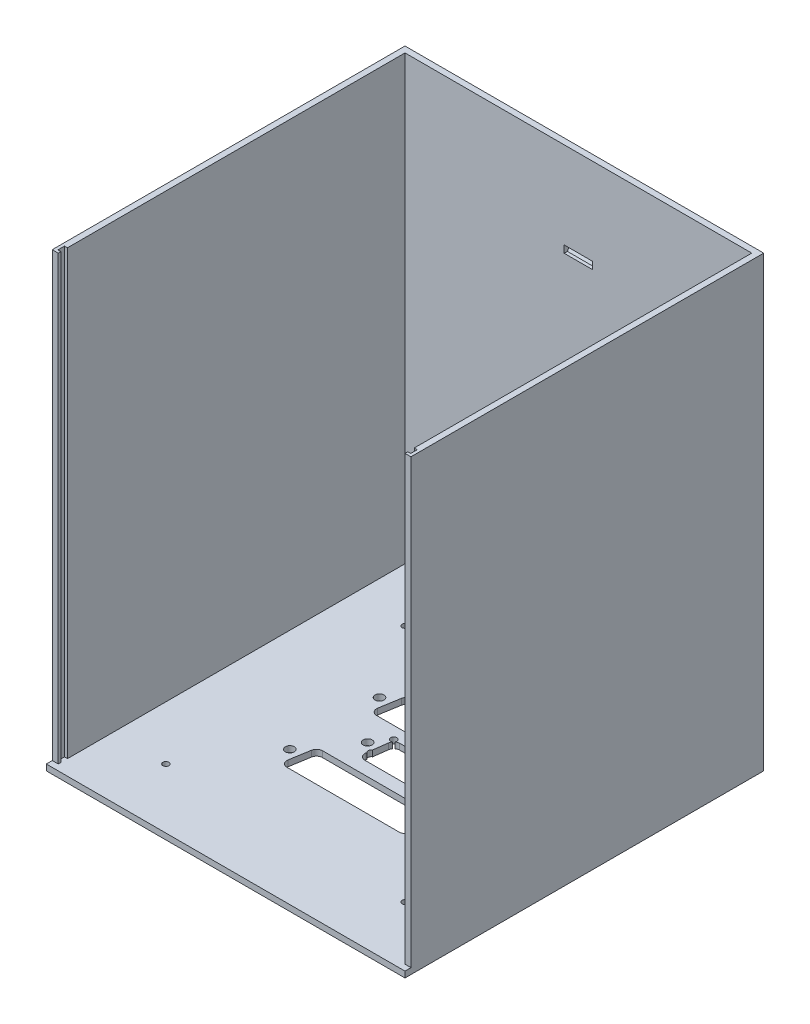
from build123d import *

# Parameters (mm, degrees)
SKETCH1_W             = 120
SKETCH1_H             = 120
MAIN_BODY_DEPTH       = 150
SKETCH11_W            = 116
SKETCH11_H            = 118
HOLLOW_DEPTH          = 148
SKETCH12_W            = 2
SKETCH12_H            = 2
LID_CUT_DEPTH         = 148
SKETCH13_W            = 1
SKETCH13_H            = 2.2
RAIL_CUT_DEPTH        = 148
MAIN_PCB_HOLES_REACH  = 174.337
SKETCH2_R             = 1
LED_PCB_HOLES_REACH   = 174.337
SKETCH3_R             = 1.05
CONNECTOR_SLOTS_REACH = 174.337
SKETCH4_R             = 1.5
CUT_EXTRUDE1_DEPTH    = 4.75


with BuildPart() as part:
    # Sketch1 → Main-Body (new body)
    with BuildSketch(Plane(origin=(0, 0, 0), x_dir=(1, 0, 0), z_dir=(0, 1, 0))):
        Rectangle(SKETCH1_W, SKETCH1_H)
    extrude(amount=MAIN_BODY_DEPTH)

    # Sketch11 → Hollow (cut)
    with BuildSketch(Plane(origin=(0, 150, 0), x_dir=(1, 0, 0), z_dir=(0, 1, 0))):
        with Locations((0, -1)):
            Rectangle(SKETCH11_W, SKETCH11_H)
    extrude(amount=-HOLLOW_DEPTH, mode=Mode.SUBTRACT)

    # Sketch12 → Lid-Cut (cut)
    with BuildSketch(Plane(origin=(0, 150, 0), x_dir=(1, 0, 0), z_dir=(0, 1, 0))):
        with Locations((-59, -59)):
            Rectangle(SKETCH12_W, SKETCH12_H)
    lid_cut = extrude(amount=-LID_CUT_DEPTH, mode=Mode.SUBTRACT)

    # Mirror-Lid-Cut: Lid-Cut across plane
    add(lid_cut.mirror(Plane(origin=(0, 0, 0), x_dir=(0, 0, 1), z_dir=(1, 0, 0))), mode=Mode.SUBTRACT)

    # Sketch13 → Rail-Cut (cut)
    with BuildSketch(Plane(origin=(0, 150, 0), x_dir=(1, 0, 0), z_dir=(0, 1, 0))):
        with Locations((-58.5, -56)):
            Rectangle(SKETCH13_W, SKETCH13_H)
    rail_cut = extrude(amount=-RAIL_CUT_DEPTH, mode=Mode.SUBTRACT)

    # Sketch2 → Main-PCB-Holes (cut, up to next)
    with BuildSketch(Plane.XZ, mode=Mode.PRIVATE) as main_pcb_holes_sk1:
        with Locations((-40, 40)):
            Circle(SKETCH2_R)
    main_pcb_holes_tool1 = extrude(main_pcb_holes_sk1.sketch, amount=-MAIN_PCB_HOLES_REACH, mode=Mode.PRIVATE) & part.part
    # Sketch2 → Main-PCB-Holes (cut, up to next)
    with BuildSketch(Plane.XZ, mode=Mode.PRIVATE) as main_pcb_holes_sk2:
        with Locations((40, 40)):
            Circle(SKETCH2_R)
    main_pcb_holes_tool2 = extrude(main_pcb_holes_sk2.sketch, amount=-MAIN_PCB_HOLES_REACH, mode=Mode.PRIVATE) & part.part
    # Sketch2 → Main-PCB-Holes (cut, up to next)
    with BuildSketch(Plane.XZ, mode=Mode.PRIVATE) as main_pcb_holes_sk3:
        with Locations((40, -40)):
            Circle(SKETCH2_R)
    main_pcb_holes_tool3 = extrude(main_pcb_holes_sk3.sketch, amount=-MAIN_PCB_HOLES_REACH, mode=Mode.PRIVATE) & part.part
    # Sketch2 → Main-PCB-Holes (cut, up to next)
    with BuildSketch(Plane.XZ, mode=Mode.PRIVATE) as main_pcb_holes_sk4:
        with Locations((-40, -40)):
            Circle(SKETCH2_R)
    main_pcb_holes_tool4 = extrude(main_pcb_holes_sk4.sketch, amount=-MAIN_PCB_HOLES_REACH, mode=Mode.PRIVATE) & part.part
    add(main_pcb_holes_tool1.solids().sort_by_distance((-40, 0, 40))[0], mode=Mode.SUBTRACT)
    add(main_pcb_holes_tool2.solids().sort_by_distance((40, 0, 40))[0], mode=Mode.SUBTRACT)
    add(main_pcb_holes_tool3.solids().sort_by_distance((40, 0, -40))[0], mode=Mode.SUBTRACT)
    add(main_pcb_holes_tool4.solids().sort_by_distance((-40, 0, -40))[0], mode=Mode.SUBTRACT)

    # Sketch3 → LED-PCB-Holes (cut, up to next)
    with BuildSketch(Plane(origin=(0, 150, 0), x_dir=(1, 0, 0), z_dir=(0, 1, 0)), mode=Mode.PRIVATE) as led_pcb_holes_sk1:
        with Locations((-9, 5.23)):
            Circle(SKETCH3_R)
    led_pcb_holes_tool1 = extrude(led_pcb_holes_sk1.sketch, amount=-LED_PCB_HOLES_REACH, mode=Mode.PRIVATE) & part.part
    # Sketch3 → LED-PCB-Holes (cut, up to next)
    with BuildSketch(Plane(origin=(0, 150, 0), x_dir=(1, 0, 0), z_dir=(0, 1, 0)), mode=Mode.PRIVATE) as led_pcb_holes_sk2:
        with Locations((9, 5.23)):
            Circle(SKETCH3_R)
    led_pcb_holes_tool2 = extrude(led_pcb_holes_sk2.sketch, amount=-LED_PCB_HOLES_REACH, mode=Mode.PRIVATE) & part.part
    # Sketch3 → LED-PCB-Holes (cut, up to next)
    with BuildSketch(Plane(origin=(0, 150, 0), x_dir=(1, 0, 0), z_dir=(0, 1, 0)), mode=Mode.PRIVATE) as led_pcb_holes_sk3:
        with Locations((9, -2.27)):
            Circle(SKETCH3_R)
    led_pcb_holes_tool3 = extrude(led_pcb_holes_sk3.sketch, amount=-LED_PCB_HOLES_REACH, mode=Mode.PRIVATE) & part.part
    # Sketch3 → LED-PCB-Holes (cut, up to next)
    with BuildSketch(Plane(origin=(0, 150, 0), x_dir=(1, 0, 0), z_dir=(0, 1, 0)), mode=Mode.PRIVATE) as led_pcb_holes_sk4:
        with Locations((-9, -2.27)):
            Circle(SKETCH3_R)
    led_pcb_holes_tool4 = extrude(led_pcb_holes_sk4.sketch, amount=-LED_PCB_HOLES_REACH, mode=Mode.PRIVATE) & part.part
    add(led_pcb_holes_tool1.solids().sort_by_distance((-9, 150, -5.23))[0], mode=Mode.SUBTRACT)
    add(led_pcb_holes_tool2.solids().sort_by_distance((9, 150, -5.23))[0], mode=Mode.SUBTRACT)
    add(led_pcb_holes_tool3.solids().sort_by_distance((9, 150, 2.27))[0], mode=Mode.SUBTRACT)
    add(led_pcb_holes_tool4.solids().sort_by_distance((-9, 150, 2.27))[0], mode=Mode.SUBTRACT)

    # Sketch4 → Connector-Slots (cut, up to next)
    with BuildSketch(Plane.XZ, mode=Mode.PRIVATE) as connector_slots_sk1:
        with Locations((-12.5, 0)):
            Circle(SKETCH4_R)
    connector_slots_tool1 = extrude(connector_slots_sk1.sketch, amount=-CONNECTOR_SLOTS_REACH, mode=Mode.PRIVATE) & part.part
    # Sketch4 → Connector-Slots (cut, up to next)
    with BuildSketch(Plane.XZ, mode=Mode.PRIVATE) as connector_slots_sk2:
        with Locations((12.5, 0)):
            Circle(SKETCH4_R)
    connector_slots_tool2 = extrude(connector_slots_sk2.sketch, amount=-CONNECTOR_SLOTS_REACH, mode=Mode.PRIVATE) & part.part
    # Sketch4 → Connector-Slots (cut, up to next)
    with BuildSketch(Plane.XZ, mode=Mode.PRIVATE) as connector_slots_sk3:
        with Locations((-23.52, -15)):
            Circle(SKETCH4_R)
    connector_slots_tool3 = extrude(connector_slots_sk3.sketch, amount=-CONNECTOR_SLOTS_REACH, mode=Mode.PRIVATE) & part.part
    # Sketch4 → Connector-Slots (cut, up to next)
    with BuildSketch(Plane.XZ, mode=Mode.PRIVATE) as connector_slots_sk4:
        with Locations((23.52, -15)):
            Circle(SKETCH4_R)
    connector_slots_tool4 = extrude(connector_slots_sk4.sketch, amount=-CONNECTOR_SLOTS_REACH, mode=Mode.PRIVATE) & part.part
    # Sketch4 → Connector-Slots (cut, up to next)
    with BuildSketch(Plane.XZ, mode=Mode.PRIVATE) as connector_slots_sk5:
        with Locations((-23.52, 15)):
            Circle(SKETCH4_R)
    connector_slots_tool5 = extrude(connector_slots_sk5.sketch, amount=-CONNECTOR_SLOTS_REACH, mode=Mode.PRIVATE) & part.part
    # Sketch4 → Connector-Slots (cut, up to next)
    with BuildSketch(Plane.XZ, mode=Mode.PRIVATE) as connector_slots_sk6:
        with Locations((23.52, 15)):
            Circle(SKETCH4_R)
    connector_slots_tool6 = extrude(connector_slots_sk6.sketch, amount=-CONNECTOR_SLOTS_REACH, mode=Mode.PRIVATE) & part.part
    # Sketch4 → Connector-Slots (cut, up to next)
    with BuildSketch(Plane.XZ, mode=Mode.PRIVATE) as connector_slots_sk7:
        with BuildLine():
            Line((-6.891594987, -5.117891943), (6.891594987, -5.117891943))
            ThreePointArc((6.891594987, -5.117891943), (8.211781315, -4.620259427), (8.875, -3.375))
            Line((8.875, -3.375), (9.75, 3.375))
            ThreePointArc((9.75, 3.375), (9.268962471, 4.952294386), (7.766594987, 5.632108057))
            Line((7.766594987, 5.632108057), (-7.766594987, 5.632108057))
            ThreePointArc((-7.766594987, 5.632108057), (-9.268962471, 4.952294386), (-9.75, 3.375))
            Line((-9.75, 3.375), (-8.875, -3.375))
            ThreePointArc((-8.875, -3.375), (-8.211781315, -4.620259427), (-6.891594987, -5.117891943))
        make_face()
    connector_slots_tool7 = extrude(connector_slots_sk7.sketch, amount=-CONNECTOR_SLOTS_REACH, mode=Mode.PRIVATE) & part.part
    # Sketch4 → Connector-Slots (cut, up to next)
    with BuildSketch(Plane.XZ, mode=Mode.PRIVATE) as connector_slots_sk8:
        with BuildLine():
            Line((-17.652212152, -20.046202025), (17.652212152, -20.046202025))
            ThreePointArc((17.652212152, -20.046202025), (18.944961945, -19.57224199), (19.625, -18.375))
            Line((19.625, -18.375), (20.75, -11.625))
            ThreePointArc((20.75, -11.625), (20.303252117, -10.003452233), (18.777212152, -9.296202025))
            Line((18.777212152, -9.296202025), (-18.777212152, -9.296202025))
            ThreePointArc((-18.777212152, -9.296202025), (-20.303252117, -10.003452233), (-20.75, -11.625))
            Line((-20.75, -11.625), (-19.625, -18.375))
            ThreePointArc((-19.625, -18.375), (-18.944961945, -19.57224199), (-17.652212152, -20.046202025))
        make_face()
    connector_slots_tool8 = extrude(connector_slots_sk8.sketch, amount=-CONNECTOR_SLOTS_REACH, mode=Mode.PRIVATE) & part.part
    # Sketch4 → Connector-Slots (cut, up to next)
    with BuildSketch(Plane.XZ, mode=Mode.PRIVATE) as connector_slots_sk9:
        with BuildLine():
            Line((-17.652212152, 9.953797975), (17.652212152, 9.953797975))
            ThreePointArc((17.652212152, 9.953797975), (18.944961945, 10.42775801), (19.625, 11.625))
            Line((19.625, 11.625), (20.75, 18.375))
            ThreePointArc((20.75, 18.375), (20.303252117, 19.996547767), (18.777212152, 20.703797975))
            Line((18.777212152, 20.703797975), (-18.777212152, 20.703797975))
            ThreePointArc((-18.777212152, 20.703797975), (-20.303252117, 19.996547767), (-20.75, 18.375))
            Line((-20.75, 18.375), (-19.625, 11.625))
            ThreePointArc((-19.625, 11.625), (-18.944961945, 10.42775801), (-17.652212152, 9.953797975))
        make_face()
    connector_slots_tool9 = extrude(connector_slots_sk9.sketch, amount=-CONNECTOR_SLOTS_REACH, mode=Mode.PRIVATE) & part.part
    add(connector_slots_tool1.solids().sort_by_distance((-12.5, 0, 0))[0], mode=Mode.SUBTRACT)
    add(connector_slots_tool2.solids().sort_by_distance((12.5, 0, 0))[0], mode=Mode.SUBTRACT)
    add(connector_slots_tool3.solids().sort_by_distance((-23.52, 0, -15))[0], mode=Mode.SUBTRACT)
    add(connector_slots_tool4.solids().sort_by_distance((23.52, 0, -15))[0], mode=Mode.SUBTRACT)
    add(connector_slots_tool5.solids().sort_by_distance((-23.52, 0, 15))[0], mode=Mode.SUBTRACT)
    add(connector_slots_tool6.solids().sort_by_distance((23.52, 0, 15))[0], mode=Mode.SUBTRACT)
    add(connector_slots_tool7.solids().sort_by_distance((0, 0, 0.368259))[0], mode=Mode.SUBTRACT)
    add(connector_slots_tool8.solids().sort_by_distance((0, 0, -14.605881))[0], mode=Mode.SUBTRACT)
    add(connector_slots_tool9.solids().sort_by_distance((0, 0, 15.394119))[0], mode=Mode.SUBTRACT)

    # Mirror-Rail-Cut: Rail-Cut across plane
    add(rail_cut.mirror(Plane(origin=(0, 0, 0), x_dir=(0, 0, 1), z_dir=(1, 0, 0))), mode=Mode.SUBTRACT)

    # Sketch14 → Cut-Extrude1 (cut, symmetric)
    with BuildSketch(Plane(origin=(0, 0, 0), x_dir=(0, 0, -1), z_dir=(1, 0, 0))):
        Polygon((58, 121), (60, 121), (60, 120.88), (60, 119.88), (59.82055535, 119.88), (59.07, 118.58), (58, 118.58), align=None)
    extrude(amount=CUT_EXTRUDE1_DEPTH, both=True, mode=Mode.SUBTRACT)


solid = part.part
